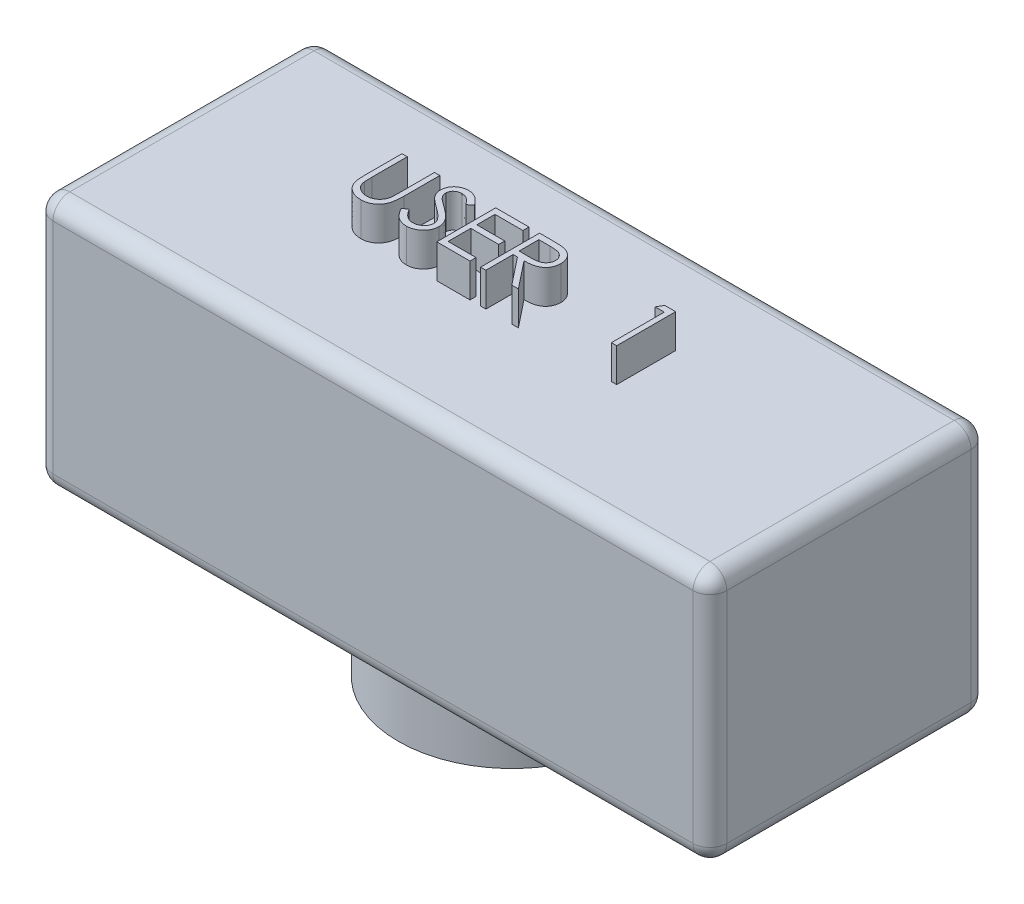
from build123d import *

# Parameters (mm, degrees)
SKETCH1_R           = 5.75
BOSS_EXTRUDE1_DEPTH = 4.5
SKETCH2_W           = 40
SKETCH2_H           = 16.5
BOSS_EXTRUDE2_DEPTH = 15
SKETCH3_R           = 6.75
BOSS_EXTRUDE3_DEPTH = 4
SKETCH5_R           = 5.75
CUT_EXTRUDE1_DEPTH  = 4
FILLET1_R           = 1
BOSS_EXTRUDE5_DEPTH = 2
FILLET2_R           = 1


with BuildPart() as part:
    # Sketch1 → Boss-Extrude1 (new body)
    with BuildSketch(Plane(origin=(0, 0, 0), x_dir=(1, 0, 0), z_dir=(0, 1, 0))):
        with Locations(Location((0, 0, 0), (0, 0, 270))):
            Circle(SKETCH1_R)
    extrude(amount=BOSS_EXTRUDE1_DEPTH)

    # Sketch2 → Boss-Extrude2 (add)
    with BuildSketch(Plane(origin=(0, 4.5, 0), x_dir=(1, 0, 0), z_dir=(0, 1, 0))):
        Rectangle(SKETCH2_W, SKETCH2_H)
    extrude(amount=BOSS_EXTRUDE2_DEPTH)

    # Sketch3 → Boss-Extrude3 (add)
    with BuildSketch(Plane.XZ.offset(-4.5)):
        with Locations(Location((0, 0, 0), (0, 0, 90))):
            Circle(SKETCH3_R)
    extrude(amount=BOSS_EXTRUDE3_DEPTH)

    # Sketch5 → Cut-Extrude1 (cut)
    with BuildSketch(Plane.XZ):
        with Locations(Location((0, 0, 0), (0, 0, 270))):
            Circle(SKETCH5_R)
    extrude(amount=-CUT_EXTRUDE1_DEPTH, mode=Mode.SUBTRACT)

    # Fillet1
    fillet1_edges = [part.edges().sort_by_distance(p)[0] for p in [
        (20, 19.5, 0),
        (0, 19.5, -8.25),
        (-20, 19.5, 0),
        (0, 19.5, 8.25),
    ]]
    fillet(fillet1_edges, radius=FILLET1_R)

    # Sketch9 → Boss-Extrude5 (add)
    # profile 1 of 5: a face of its own
    with BuildSketch(Plane(origin=(0, 19.5, 0), x_dir=(1, 0, 0), z_dir=(0, 1, 0))):
        with BuildLine():
            Line((-9.101327965, 2.570923135), (-8.787225401, 2.570923135))
            Line((-8.787225401, 2.570923135), (-8.787225401, 0.473867847))
            add(Edge.make_bspline(
                [(-8.787225401, 0.473867847), (-8.787272145, 0.444187111), (-8.78736085, 0.3878628), (-8.786768336, 0.307694499), (-8.785108967, 0.23642204), (-8.784062808, 0.173770693), (-8.781735474, 0.120027945), (-8.779837427, 0.074902635), (-8.777396871, 0.038608432), (-8.774463753, 0.017427506), (-8.773202965, 0.008322975)],
                knots=[0, 0, 0, 0, 1.528628734, 2.90083645, 4.128790002, 5.200304208, 6.127813768, 6.898992206, 7.526736466, 8, 8, 8, 8], degree=3))
            add(Edge.make_bspline(
                [(-8.773202965, 0.008322975), (-8.768025506, -0.024523789), (-8.75796232, -0.088366518), (-8.732315942, -0.179274799), (-8.696498441, -0.261206258), (-8.654055398, -0.336717549), (-8.598122787, -0.403706909), (-8.531119252, -0.465418562), (-8.449941483, -0.519390366), (-8.359680877, -0.568741178), (-8.26239564, -0.608406261), (-8.162984374, -0.638399625), (-8.062941394, -0.656678525), (-7.995965229, -0.658795064), (-7.96270617, -0.659846096)],
                knots=[0, 0, 0, 0, 1.035780045, 2.013197591, 2.933192213, 3.817615948, 4.702609284, 5.640816605, 6.646850145, 7.73207398, 8.84249596, 9.914020372, 10.964143139, 12, 12, 12, 12], degree=3))
            add(Edge.make_bspline(
                [(-7.96270617, -0.659846096), (-7.93415243, -0.658772245), (-7.877209868, -0.656630747), (-7.792603437, -0.643369316), (-7.710203328, -0.61946875), (-7.629602649, -0.588628992), (-7.554051664, -0.547881401), (-7.483508222, -0.500810561), (-7.420544288, -0.445599685), (-7.36308629, -0.384499341), (-7.313051354, -0.315559541), (-7.269680213, -0.240281403), (-7.234154283, -0.157532056), (-7.216610758, -0.099377634), (-7.207597997, -0.069501544)],
                knots=[0, 0, 0, 0, 0.994687771, 1.983630487, 2.973142513, 3.978332533, 4.983357753, 5.956394766, 6.925816176, 7.893390482, 8.871859704, 9.88551698, 10.913711441, 12, 12, 12, 12], degree=3))
            add(Edge.make_bspline(
                [(-7.207597997, -0.069501544), (-7.204597872, -0.05715297), (-7.197912384, -0.02963537), (-7.191665339, 0.016885921), (-7.185158813, 0.071775285), (-7.180644243, 0.135427097), (-7.176243023, 0.20762807), (-7.17360995, 0.288754327), (-7.172392917, 0.378511288), (-7.172030237, 0.44114845), (-7.171840785, 0.473867847)],
                knots=[0, 0, 0, 0, 0.558680831, 1.244966039, 2.062412453, 2.990489873, 4.051219941, 5.244515665, 6.560634259, 8, 8, 8, 8], degree=3))
            Line((-7.171840785, 0.473867847), (-7.171840785, 2.570923135))
            Line((-7.171840785, 2.570923135), (-6.857738221, 2.570923135))
            Line((-6.857738221, 2.570923135), (-6.857738221, 0.457040924))
            add(Edge.make_bspline(
                [(-6.857738221, 0.457040924), (-6.857992342, 0.418942545), (-6.858488273, 0.344591242), (-6.86278885, 0.235639883), (-6.869645849, 0.132286901), (-6.879333937, 0.034518405), (-6.892170941, -0.057315754), (-6.906446161, -0.144020523), (-6.924625694, -0.224973515), (-6.945859095, -0.300805933), (-6.970132643, -0.372991446), (-7.001573792, -0.441500061), (-7.036998292, -0.508414461), (-7.079012945, -0.572722569), (-7.126224327, -0.634709123), (-7.179676008, -0.693998198), (-7.237600169, -0.751537244), (-7.300959728, -0.80585031), (-7.368710254, -0.855658987), (-7.440650211, -0.899456758), (-7.516226981, -0.936480375), (-7.595244107, -0.9669563), (-7.67773531, -0.989870899), (-7.76370267, -1.006946055), (-7.853341863, -1.016648352), (-7.914306519, -1.018090282), (-7.945178125, -1.018820455)],
                knots=[0, 0, 0, 0, 1.316592851, 2.569410997, 3.76748051, 4.895814652, 5.963796859, 6.97159953, 7.931736103, 8.829262218, 9.692595152, 10.560224239, 11.431080259, 12.30701507, 13.211635791, 14.121146779, 15.063487852, 16.031507147, 17.00238618, 17.966455255, 18.938106653, 19.907068911, 20.888905087, 21.893141452, 22.933117798, 24, 24, 24, 24], degree=3))
            add(Edge.make_bspline(
                [(-7.945178125, -1.018820455), (-7.978847228, -1.018035689), (-8.044905887, -1.016495983), (-8.142243954, -1.007673233), (-8.23555815, -0.991054838), (-8.325834027, -0.969894895), (-8.411842524, -0.940711157), (-8.494735969, -0.906613032), (-8.57309465, -0.864735772), (-8.648189779, -0.818142379), (-8.718014535, -0.765717741), (-8.782111938, -0.708577567), (-8.840587808, -0.64763719), (-8.892456505, -0.582236824), (-8.938577389, -0.512885117), (-8.978307603, -0.439385877), (-9.012420847, -0.361767561), (-9.030027414, -0.30781436), (-9.038928125, -0.280539205)],
                knots=[0, 0, 0, 0, 1.13879206, 2.234305948, 3.301075583, 4.341971843, 5.366689343, 6.369221514, 7.369726634, 8.367512178, 9.355451585, 10.318319045, 11.268648973, 12.207971039, 13.137398894, 14.081662264, 15.030215811, 16, 16, 16, 16], degree=3))
            add(Edge.make_bspline(
                [(-9.038928125, -0.280539205), (-9.044105283, -0.26190663), (-9.055334655, -0.221492161), (-9.067359952, -0.154605673), (-9.077469034, -0.077590755), (-9.086974592, 0.009557863), (-9.09258355, 0.10690773), (-9.097500989, 0.214416646), (-9.101362608, 0.332214607), (-9.101339835, 0.414269123), (-9.101327965, 0.457040924)],
                knots=[0, 0, 0, 0, 0.625038921, 1.35572334, 2.194682327, 3.136881307, 4.189498639, 5.346923369, 6.617055217, 8, 8, 8, 8], degree=3))
            Line((-9.101327965, 0.457040924), (-9.101327965, 2.570923135))
        make_face()
    # profile 2 of 5: a face of its own
    with BuildSketch(Plane(origin=(0, 19.5, 0), x_dir=(1, 0, 0), z_dir=(0, 1, 0))):
        with BuildLine():
            Line((-6.319276683, -0.253896576), (-6.023403285, -0.076512762))
            add(Edge.make_bspline(
                [(-6.023403285, -0.076512762), (-5.995885048, -0.122577147), (-5.943161168, -0.210834731), (-5.855209808, -0.330092772), (-5.764076897, -0.431454928), (-5.669087564, -0.514331536), (-5.570821616, -0.579580423), (-5.468637562, -0.625782654), (-5.362879751, -0.65459863), (-5.29090593, -0.658098716), (-5.254973798, -0.659846096)],
                knots=[0, 0, 0, 0, 1.272034388, 2.437168799, 3.508375237, 4.49857839, 5.41946034, 6.295179144, 7.148887113, 8, 8, 8, 8], degree=3))
            add(Edge.make_bspline(
                [(-5.254973798, -0.659846096), (-5.224286938, -0.658991423), (-5.163450165, -0.657297033), (-5.073887922, -0.641016231), (-4.98690612, -0.616004102), (-4.904297482, -0.58018317), (-4.827201867, -0.536844685), (-4.759595172, -0.484498507), (-4.701149059, -0.425892301), (-4.653339944, -0.360509647), (-4.616659909, -0.290192498), (-4.58846784, -0.218016547), (-4.572822767, -0.142847979), (-4.570466013, -0.092237516), (-4.569276683, -0.066697057)],
                knots=[0, 0, 0, 0, 1.095163259, 2.171163733, 3.241058638, 4.321873601, 5.38011039, 6.391990106, 7.366004449, 8.327778327, 9.272591725, 10.192022065, 11.087607919, 12, 12, 12, 12], degree=3))
            add(Edge.make_bspline(
                [(-4.569276683, -0.066697057), (-4.570750994, -0.037556208), (-4.573748052, 0.021682882), (-4.599079532, 0.109082535), (-4.638928779, 0.195575105), (-4.675691422, 0.24907637), (-4.694777484, 0.276852622)],
                knots=[0, 0, 0, 0, 0.938893495, 1.908633276, 2.914225137, 4, 4, 4, 4], degree=3))
            add(Edge.make_bspline(
                [(-4.694777484, 0.276852622), (-4.710448098, 0.296899446), (-4.743346593, 0.338985244), (-4.799904105, 0.40163048), (-4.86627022, 0.466248899), (-4.940173774, 0.535307956), (-5.024306863, 0.605595753), (-5.116034378, 0.68046403), (-5.217698237, 0.757065607), (-5.288997733, 0.808438173), (-5.3257871, 0.834945571)],
                knots=[0, 0, 0, 0, 0.722233717, 1.516239348, 2.393582979, 3.351407094, 4.387010283, 5.505090956, 6.712668013, 8, 8, 8, 8], degree=3))
            add(Edge.make_bspline(
                [(-5.3257871, 0.834945571), (-5.362611096, 0.861174159), (-5.433015772, 0.911321221), (-5.531474355, 0.985745505), (-5.619518818, 1.053789374), (-5.696757834, 1.116093387), (-5.763157431, 1.172665991), (-5.819240842, 1.22296393), (-5.863579399, 1.268347491), (-5.88823498, 1.297788833), (-5.899304728, 1.31100727)],
                knots=[0, 0, 0, 0, 1.452282411, 2.77665338, 3.964542531, 5.026858415, 5.96415736, 6.766646006, 7.446254459, 8, 8, 8, 8], degree=3))
            add(Edge.make_bspline(
                [(-5.899304728, 1.31100727), (-5.914777273, 1.331608307), (-5.94520611, 1.37212301), (-5.985372115, 1.435447868), (-6.019511278, 1.500271134), (-6.04627361, 1.566766998), (-6.068809829, 1.634001927), (-6.08396776, 1.702853173), (-6.093459157, 1.773011791), (-6.094431143, 1.820225292), (-6.094917709, 1.843859834)],
                knots=[0, 0, 0, 0, 1.068054152, 2.10047183, 3.106115577, 4.101338837, 5.06977816, 6.043150881, 7.020423561, 8, 8, 8, 8], degree=3))
            add(Edge.make_bspline(
                [(-6.094917709, 1.843859834), (-6.0936125, 1.880889608), (-6.091029979, 1.954157672), (-6.069189462, 2.061188503), (-6.034716569, 2.16337492), (-5.986421681, 2.259705253), (-5.924164328, 2.347671234), (-5.852118353, 2.428284721), (-5.766306867, 2.496053304), (-5.672154244, 2.555265362), (-5.569097872, 2.601611287), (-5.461106968, 2.636572267), (-5.348009896, 2.656381525), (-5.271406762, 2.65922429), (-5.232537901, 2.660666725)],
                knots=[0, 0, 0, 0, 1.005424448, 1.989358655, 2.955360095, 3.929531133, 4.905563448, 5.876582895, 6.856512386, 7.866279853, 8.892233794, 9.918561126, 10.94386622, 12, 12, 12, 12], degree=3))
            add(Edge.make_bspline(
                [(-5.232537901, 2.660666725), (-5.191293801, 2.659244173), (-5.109272449, 2.656415172), (-4.988623233, 2.631817641), (-4.872462517, 2.591116969), (-4.779019252, 2.544928311), (-4.705886491, 2.498796895), (-4.650113758, 2.456777071), (-4.593596307, 2.408401962), (-4.535878252, 2.353542716), (-4.477937593, 2.291695965), (-4.418914141, 2.223285276), (-4.358669872, 2.148728721), (-4.319914012, 2.09550422), (-4.300045914, 2.068218808)],
                knots=[0, 0, 0, 0, 1.286793592, 2.559021753, 3.825965368, 5.121522368, 5.803751409, 6.523245864, 7.299691795, 8.125521123, 9.008227632, 9.944561021, 10.946284179, 12, 12, 12, 12], degree=3))
            Line((-4.300045914, 2.068218808), (-4.584000241, 1.852974417))
            add(Edge.make_bspline(
                [(-4.584000241, 1.852974417), (-4.601146173, 1.875063108), (-4.63416523, 1.917600761), (-4.684294717, 1.977172076), (-4.731543365, 2.031588556), (-4.778093765, 2.078853684), (-4.821487396, 2.121555817), (-4.863604438, 2.158115574), (-4.90383879, 2.18889117), (-4.9545557, 2.22173473), (-5.018273419, 2.254291233), (-5.098257955, 2.281840311), (-5.18184423, 2.298395373), (-5.238773861, 2.300584261), (-5.267593991, 2.301692366)],
                knots=[0, 0, 0, 0, 1.181633172, 2.275549214, 3.290209073, 4.226197932, 5.078386478, 5.862611352, 6.581680152, 7.217281963, 8.414376989, 9.595101626, 10.782541182, 12, 12, 12, 12], degree=3))
            add(Edge.make_bspline(
                [(-5.267593991, 2.301692366), (-5.303750513, 2.300480666), (-5.37347496, 2.298144017), (-5.472465197, 2.272624031), (-5.561559122, 2.232442171), (-5.638111687, 2.176127193), (-5.701848664, 2.1094062), (-5.747954122, 2.032627345), (-5.775704287, 1.947844943), (-5.779090567, 1.888703286), (-5.780815144, 1.858583392)],
                knots=[0, 0, 0, 0, 1.14458467, 2.207223713, 3.21896685, 4.227309161, 5.202851033, 6.127160689, 7.046193047, 8, 8, 8, 8], degree=3))
            add(Edge.make_bspline(
                [(-5.780815144, 1.858583392), (-5.780422018, 1.839831913), (-5.779635122, 1.802298294), (-5.768660324, 1.746846872), (-5.754560995, 1.691535532), (-5.732218363, 1.636612949), (-5.70137306, 1.58111859), (-5.660867884, 1.524096853), (-5.609854572, 1.465045144), (-5.570777559, 1.42663777), (-5.550146074, 1.406359834)],
                knots=[0, 0, 0, 0, 0.858281714, 1.717966888, 2.583508476, 3.4729293, 4.427298488, 5.488583878, 6.674047936, 8, 8, 8, 8], degree=3))
            add(Edge.make_bspline(
                [(-5.550146074, 1.406359834), (-5.542484702, 1.399522808), (-5.524283034, 1.3832796), (-5.491007109, 1.356687319), (-5.44706431, 1.323884547), (-5.393602109, 1.28329723), (-5.329634748, 1.236215768), (-5.255155191, 1.183242156), (-5.170993659, 1.122656697), (-5.111271743, 1.080299156), (-5.07969335, 1.057902302)],
                knots=[0, 0, 0, 0, 0.420754252, 0.999615792, 1.744751191, 2.668019286, 3.750313428, 4.999500688, 6.413464383, 8, 8, 8, 8], degree=3))
            add(Edge.make_bspline(
                [(-5.07969335, 1.057902302), (-5.041707436, 1.030260942), (-4.96815298, 0.97673728), (-4.8634954, 0.8963216), (-4.768601592, 0.817673832), (-4.683138388, 0.741296225), (-4.60626148, 0.667768132), (-4.538823759, 0.596204951), (-4.480138079, 0.527119379), (-4.41695886, 0.438546803), (-4.352401041, 0.329765719), (-4.296959533, 0.19648748), (-4.262001186, 0.06269116), (-4.257429671, -0.027235677), (-4.255174119, -0.07160491)],
                knots=[0, 0, 0, 0, 1.163667725, 2.253281268, 3.268753668, 4.215851969, 5.092017293, 5.902905408, 6.650798638, 7.335211899, 8.59617414, 9.77448103, 10.901945474, 12, 12, 12, 12], degree=3))
            add(Edge.make_bspline(
                [(-4.255174119, -0.07160491), (-4.255831257, -0.102983275), (-4.257132772, -0.165130658), (-4.272093686, -0.256385735), (-4.294013351, -0.345016605), (-4.327050585, -0.429927717), (-4.367373743, -0.51267248), (-4.418539991, -0.591080381), (-4.477847676, -0.666886779), (-4.545881441, -0.73807027), (-4.620327343, -0.803416466), (-4.699011038, -0.861545528), (-4.782061311, -0.910013851), (-4.869027627, -0.949564693), (-4.959929964, -0.980498211), (-5.054737748, -1.00291108), (-5.153607259, -1.016666791), (-5.220807741, -1.018094552), (-5.254973798, -1.018820455)],
                knots=[0, 0, 0, 0, 0.983748083, 1.948392443, 2.894712957, 3.844097841, 4.80183111, 5.778335162, 6.776009319, 7.81870978, 8.863265674, 9.881300176, 10.883814829, 11.87499822, 12.874611388, 13.892143829, 14.928324115, 16, 16, 16, 16], degree=3))
            add(Edge.make_bspline(
                [(-5.254973798, -1.018820455), (-5.281409141, -1.018309273), (-5.333946901, -1.017293348), (-5.411656383, -1.008312067), (-5.487795972, -0.995604964), (-5.561410254, -0.975430894), (-5.633447666, -0.950953917), (-5.703594901, -0.920815584), (-5.771885954, -0.884698383), (-5.838703537, -0.843403358), (-5.903877712, -0.795345613), (-5.96679718, -0.739372117), (-6.029526365, -0.677026612), (-6.090213762, -0.606616049), (-6.150086906, -0.529277966), (-6.207965316, -0.444288782), (-6.265047033, -0.352111429), (-6.300862501, -0.287246343), (-6.319276683, -0.253896576)],
                knots=[0, 0, 0, 0, 0.915332311, 1.819136955, 2.706846663, 3.586547465, 4.459518054, 5.340707479, 6.227863349, 7.133153174, 8.059268498, 9.028702269, 10.047606654, 11.120612155, 12.245963614, 13.433783089, 14.680604001, 16, 16, 16, 16], degree=3))
        make_face()
    # profile 3 of 5: a face of its own
    with BuildSketch(Plane(origin=(0, 19.5, 0), x_dir=(1, 0, 0), z_dir=(0, 1, 0))):
        Polygon((-3.537225401, 2.570923135), (-1.562866427, 2.570923135), (-1.562866427, 2.211948776), (-3.223122837, 2.211948776), (-3.223122837, 1.135025699), (-1.562866427, 1.135025699), (-1.562866427, 0.77605134), (-3.223122837, 0.77605134), (-3.223122837, -0.570102506), (-1.562866427, -0.570102506), (-1.562866427, -0.929076865), (-3.537225401, -0.929076865), align=None)
    # profile 4 of 5: a face of its own
    with BuildSketch(Plane(origin=(0, 19.5, 0), x_dir=(1, 0, 0), z_dir=(0, 1, 0))):
        with BuildLine():
            Line((-0.934661298, 2.570923135), (-0.234240625, 2.570923135))
            add(Edge.make_bspline(
                [(-0.234240625, 2.570923135), (-0.187499497, 2.570767549), (-0.097751352, 2.570468807), (0.030821918, 2.568803044), (0.147649015, 2.564028688), (0.252668854, 2.559920105), (0.345879509, 2.552428163), (0.4275668, 2.545267516), (0.497354498, 2.535893855), (0.539600349, 2.527188432), (0.558728125, 2.523246853)],
                knots=[0, 0, 0, 0, 1.410062039, 2.707475311, 3.878576406, 4.937260626, 5.877586885, 6.699081471, 7.410979367, 8, 8, 8, 8], degree=3))
            add(Edge.make_bspline(
                [(0.558728125, 2.523246853), (0.584334749, 2.516920088), (0.635001738, 2.504401524), (0.707951804, 2.477941923), (0.777466128, 2.447322299), (0.843255953, 2.411358578), (0.904991744, 2.369783799), (0.963310055, 2.323315676), (1.018475518, 2.27220847), (1.068257148, 2.215173629), (1.1151962, 2.155337119), (1.154784826, 2.090633362), (1.188911306, 2.022971835), (1.216081823, 1.951664417), (1.237959797, 1.877402645), (1.253386036, 1.799513848), (1.262637224, 1.718352873), (1.263579079, 1.662994965), (1.26405665, 1.634925539)],
                knots=[0, 0, 0, 0, 1.027469482, 2.033020251, 3.019912614, 3.986113645, 4.951240523, 5.91722682, 6.890402269, 7.87763091, 8.8651537, 9.85103654, 10.82876324, 11.815024772, 12.821070561, 13.842952187, 14.906261191, 16, 16, 16, 16], degree=3))
            add(Edge.make_bspline(
                [(1.26405665, 1.634925539), (1.262587652, 1.588290434), (1.259721257, 1.497293266), (1.232996153, 1.365232385), (1.189219633, 1.24204307), (1.128896344, 1.127880432), (1.052076868, 1.024969787), (0.959752077, 0.934579332), (0.851870466, 0.858939419), (0.75144115, 0.806486615), (0.66272695, 0.772893706), (0.589693637, 0.749257347), (0.51002666, 0.730995382), (0.424489325, 0.71463525), (0.33272567, 0.702283556), (0.23495563, 0.693236961), (0.131109479, 0.687582912), (0.059770409, 0.686740908), (0.023071073, 0.68630775)],
                knots=[0, 0, 0, 0, 1.260483769, 2.459530307, 3.627416485, 4.787058657, 5.939039949, 7.08810263, 8.267026773, 9.491475466, 10.141966685, 10.831826277, 11.566392101, 12.351337768, 13.187381173, 14.07005841, 15.007169909, 16, 16, 16, 16], degree=3))
            Line((0.023071073, 0.68630775), (1.308928445, -0.929076865))
            Line((1.308928445, -0.929076865), (0.920506971, -0.929076865))
            Line((0.920506971, -0.929076865), (-0.365350401, 0.68630775))
            Line((-0.365350401, 0.68630775), (-0.620558734, 0.68630775))
            Line((-0.620558734, 0.68630775), (-0.620558734, -0.929076865))
            Line((-0.620558734, -0.929076865), (-0.934661298, -0.929076865))
            Line((-0.934661298, -0.929076865), (-0.934661298, 2.570923135))
        make_face()
        with BuildLine():
            Line((-0.620558734, 2.211948776), (-0.620558734, 1.045282109))
            Line((-0.620558734, 1.045282109), (0.020266586, 1.040374257))
            add(Edge.make_bspline(
                [(0.020266586, 1.040374257), (0.050186625, 1.04036102), (0.108180182, 1.040335364), (0.192080847, 1.04432914), (0.270200959, 1.048872458), (0.342241711, 1.055821804), (0.408235286, 1.064777876), (0.4681487, 1.07598086), (0.522079751, 1.089032922), (0.58497829, 1.109234548), (0.655214821, 1.141240567), (0.731546281, 1.187806065), (0.796548619, 1.246375184), (0.851466481, 1.31334864), (0.895595913, 1.386984889), (0.926707967, 1.466401258), (0.946450409, 1.549592856), (0.948778955, 1.606770964), (0.949954086, 1.635626661)],
                knots=[0, 0, 0, 0, 1.146690395, 2.22261258, 3.21895312, 4.145990853, 4.996080663, 5.770904154, 6.481378293, 7.121626537, 8.300444488, 9.431385265, 10.535395872, 11.636531494, 12.74115979, 13.810798291, 14.895190096, 16, 16, 16, 16], degree=3))
            add(Edge.make_bspline(
                [(0.949954086, 1.635626661), (0.948751965, 1.663773234), (0.9463698, 1.719549473), (0.926921031, 1.801205383), (0.89403165, 1.878272334), (0.849709412, 1.950436819), (0.795710257, 2.015942554), (0.732392444, 2.071989707), (0.661487249, 2.118239172), (0.595216051, 2.147793553), (0.535981838, 2.165913406), (0.484552178, 2.17866457), (0.426440701, 2.188909039), (0.361365242, 2.1971171), (0.289603611, 2.204172044), (0.21079296, 2.208923822), (0.12545618, 2.211737687), (0.066309249, 2.211876775), (0.035691266, 2.211948776)],
                knots=[0, 0, 0, 0, 1.101028733, 2.181837193, 3.264309656, 4.369019818, 5.486613113, 6.575447106, 7.666700264, 8.788928104, 9.402425223, 10.0903467, 10.862060571, 11.710948788, 12.657782767, 13.684531032, 14.801375019, 16, 16, 16, 16], degree=3))
            Line((0.035691266, 2.211948776), (-0.620558734, 2.211948776))
        make_face(mode=Mode.SUBTRACT)
    # profile 5 of 5: a face of its own
    with BuildSketch(Plane(origin=(0, 19.5, 0), x_dir=(1, 0, 0), z_dir=(0, 1, 0))):
        Polygon((6.495126362, 2.570923135), (7.142261779, 2.570923135), (7.142261779, -0.929076865), (6.828159215, -0.929076865), (6.828159215, 2.211948776), (6.289697676, 2.211948776), align=None)
    extrude(amount=BOSS_EXTRUDE5_DEPTH)

    # Fillet2
    # the kernel refuses this fillet: 1 mm, written as the material it takes off along each edge
    with BuildSketch(Plane(origin=(-19, 18.5, 7.25), x_dir=(0, 0, 1), z_dir=(-1, 0, 0))) as fillet2_piece_1_section:
        Polygon((0, 0), (FILLET2_R, 0), (FILLET2_R, FILLET2_R), (0, FILLET2_R), align=None)
    fillet2_piece_1 = extrude(amount=FILLET2_R, mode=Mode.PRIVATE)
    fillet2_piece_1 = fillet2_piece_1 - Plane(origin=(-19, 18.5, 7.25), x_dir=(0, -0.7071067811865475, -0.7071067811865475), z_dir=(-1, 0, 0)) * Sphere(FILLET2_R, mode=Mode.PRIVATE)
    add(fillet2_piece_1, mode=Mode.SUBTRACT)
    with BuildSketch(Plane(origin=(-19, 18.5, -7.25), x_dir=(-1, 0, 0), z_dir=(0, 0, -1))) as fillet2_piece_2_section:
        Polygon((0, 0), (FILLET2_R, 0), (FILLET2_R, FILLET2_R), (0, FILLET2_R), align=None)
    fillet2_piece_2 = extrude(amount=FILLET2_R, mode=Mode.PRIVATE)
    fillet2_piece_2 = fillet2_piece_2 - Plane(origin=(-19, 18.5, -7.25), x_dir=(0.7071067811865475, -0.7071067811865475, 0), z_dir=(0, 0, -1)) * Sphere(FILLET2_R, mode=Mode.PRIVATE)
    add(fillet2_piece_2, mode=Mode.SUBTRACT)
    with BuildSketch(Plane(origin=(19, 18.5, 7.25), x_dir=(0, 0, 1), z_dir=(1, 0, 0))) as fillet2_piece_3_section:
        Polygon((0, 0), (FILLET2_R, 0), (FILLET2_R, -FILLET2_R), (0, -FILLET2_R), align=None)
    fillet2_piece_3 = extrude(amount=FILLET2_R, mode=Mode.PRIVATE)
    fillet2_piece_3 = fillet2_piece_3 - Plane(origin=(19, 18.5, 7.25), x_dir=(0, -0.7071067811865475, -0.7071067811865475), z_dir=(1, 0, 0)) * Sphere(FILLET2_R, mode=Mode.PRIVATE)
    add(fillet2_piece_3, mode=Mode.SUBTRACT)
    with BuildSketch(Plane(origin=(19, 18.5, -7.25), x_dir=(1, 0, 0), z_dir=(0, 0, -1))) as fillet2_piece_4_section:
        Polygon((0, 0), (FILLET2_R, 0), (FILLET2_R, -FILLET2_R), (0, -FILLET2_R), align=None)
    fillet2_piece_4 = extrude(amount=FILLET2_R, mode=Mode.PRIVATE)
    fillet2_piece_4 = fillet2_piece_4 - Plane(origin=(19, 18.5, -7.25), x_dir=(-0.7071067811865475, -0.7071067811865475, 0), z_dir=(0, 0, -1)) * Sphere(FILLET2_R, mode=Mode.PRIVATE)
    add(fillet2_piece_4, mode=Mode.SUBTRACT)
    with BuildSketch(Plane(origin=(19, 5.5, -7.25), x_dir=(0, -1, 0), z_dir=(0, 0, -1))) as fillet2_piece_5_section:
        Polygon((0, 0), (FILLET2_R, 0), (FILLET2_R, -FILLET2_R), (0, -FILLET2_R), align=None)
    fillet2_piece_5 = extrude(amount=FILLET2_R, mode=Mode.PRIVATE)
    fillet2_piece_5 = fillet2_piece_5 - Plane(origin=(19, 5.5, -7.25), x_dir=(-0.7071067811865475, 0.7071067811865475, 0), z_dir=(0, 0, -1)) * Sphere(FILLET2_R, mode=Mode.PRIVATE)
    add(fillet2_piece_5, mode=Mode.SUBTRACT)
    with BuildSketch(Plane(origin=(19, 5.5, 7.25), x_dir=(1, 0, 0), z_dir=(0, -1, 0))) as fillet2_piece_6_section:
        Polygon((0, 0), (FILLET2_R, 0), (FILLET2_R, FILLET2_R), (0, FILLET2_R), align=None)
    fillet2_piece_6 = extrude(amount=FILLET2_R, mode=Mode.PRIVATE)
    fillet2_piece_6 = fillet2_piece_6 - Plane(origin=(19, 5.5, 7.25), x_dir=(-0.7071067811865475, 0, -0.7071067811865475), z_dir=(0, -1, 0)) * Sphere(FILLET2_R, mode=Mode.PRIVATE)
    add(fillet2_piece_6, mode=Mode.SUBTRACT)
    with BuildSketch(Plane(origin=(-19, 5.5, 7.25), x_dir=(0, -1, 0), z_dir=(-1, 0, 0))) as fillet2_piece_7_section:
        Polygon((0, 0), (FILLET2_R, 0), (FILLET2_R, FILLET2_R), (0, FILLET2_R), align=None)
    fillet2_piece_7 = extrude(amount=FILLET2_R, mode=Mode.PRIVATE)
    fillet2_piece_7 = fillet2_piece_7 - Plane(origin=(-19, 5.5, 7.25), x_dir=(0, 0.7071067811865475, -0.7071067811865475), z_dir=(-1, 0, 0)) * Sphere(FILLET2_R, mode=Mode.PRIVATE)
    add(fillet2_piece_7, mode=Mode.SUBTRACT)
    with BuildSketch(Plane(origin=(-19, 5.5, -7.25), x_dir=(-1, 0, 0), z_dir=(0, 0, -1))) as fillet2_piece_8_section:
        Polygon((0, 0), (FILLET2_R, 0), (FILLET2_R, -FILLET2_R), (0, -FILLET2_R), align=None)
    fillet2_piece_8 = extrude(amount=FILLET2_R, mode=Mode.PRIVATE)
    fillet2_piece_8 = fillet2_piece_8 - Plane(origin=(-19, 5.5, -7.25), x_dir=(0.7071067811865475, 0.7071067811865475, 0), z_dir=(0, 0, -1)) * Sphere(FILLET2_R, mode=Mode.PRIVATE)
    add(fillet2_piece_8, mode=Mode.SUBTRACT)
    with BuildSketch(Plane(origin=(20, 5.5, -8.25), x_dir=(-1, 0, 0), z_dir=(0, 1, 0)), Plane(origin=(20, 5.5, 8.25), x_dir=(0, 0, -1), z_dir=(0, 1, 0))) as fillet2_piece_9:
        with BuildLine():
            CenterArc((FILLET2_R, FILLET2_R), FILLET2_R, 180, 90)
            Line((0, FILLET2_R), (0, 0))
            Line((0, 0), (FILLET2_R, 0))
        make_face()
    extrude(amount=13, mode=Mode.SUBTRACT)
    with BuildSketch(Plane(origin=(-20, 5.5, 8.25), x_dir=(0, 0, -1), z_dir=(0, 1, 0)), Plane(origin=(-20, 5.5, -8.25), x_dir=(1, 0, 0), z_dir=(0, 1, 0))) as fillet2_piece_10:
        with BuildLine():
            CenterArc((FILLET2_R, -FILLET2_R), FILLET2_R, 90, 90)
            Line((0, -FILLET2_R), (0, 0))
            Line((0, 0), (FILLET2_R, 0))
        make_face()
    extrude(amount=13, mode=Mode.SUBTRACT)
    with BuildSketch(Plane(origin=(20, 4.5, -7.25), x_dir=(-1, 0, 0), z_dir=(0, 0, 1))) as fillet2_piece_11:
        with BuildLine():
            CenterArc((FILLET2_R, -FILLET2_R), FILLET2_R, 90, 90)
            Line((0, -FILLET2_R), (0, 0))
            Line((0, 0), (FILLET2_R, 0))
        make_face()
    extrude(amount=14.5, mode=Mode.SUBTRACT)
    with BuildSketch(Plane(origin=(-19, 4.5, -8.25), x_dir=(0, 1, 0), z_dir=(1, 0, 0))) as fillet2_piece_12:
        with BuildLine():
            CenterArc((FILLET2_R, FILLET2_R), FILLET2_R, 180, 90)
            Line((0, FILLET2_R), (0, 0))
            Line((0, 0), (FILLET2_R, 0))
        make_face()
    extrude(amount=38, mode=Mode.SUBTRACT)
    with BuildSketch(Plane(origin=(-20, 4.5, 7.25), x_dir=(0, 1, 0), z_dir=(0, 0, -1))) as fillet2_piece_13:
        with BuildLine():
            CenterArc((FILLET2_R, FILLET2_R), FILLET2_R, 180, 90)
            Line((0, FILLET2_R), (0, 0))
            Line((0, 0), (FILLET2_R, 0))
        make_face()
    extrude(amount=14.5, mode=Mode.SUBTRACT)
    with BuildSketch(Plane(origin=(19, 4.5, 8.25), x_dir=(0, 0, -1), z_dir=(-1, 0, 0))) as fillet2_piece_14:
        with BuildLine():
            CenterArc((FILLET2_R, -FILLET2_R), FILLET2_R, 90, 90)
            Line((0, -FILLET2_R), (0, 0))
            Line((0, 0), (FILLET2_R, 0))
        make_face()
    extrude(amount=38, mode=Mode.SUBTRACT)


solid = part.part
